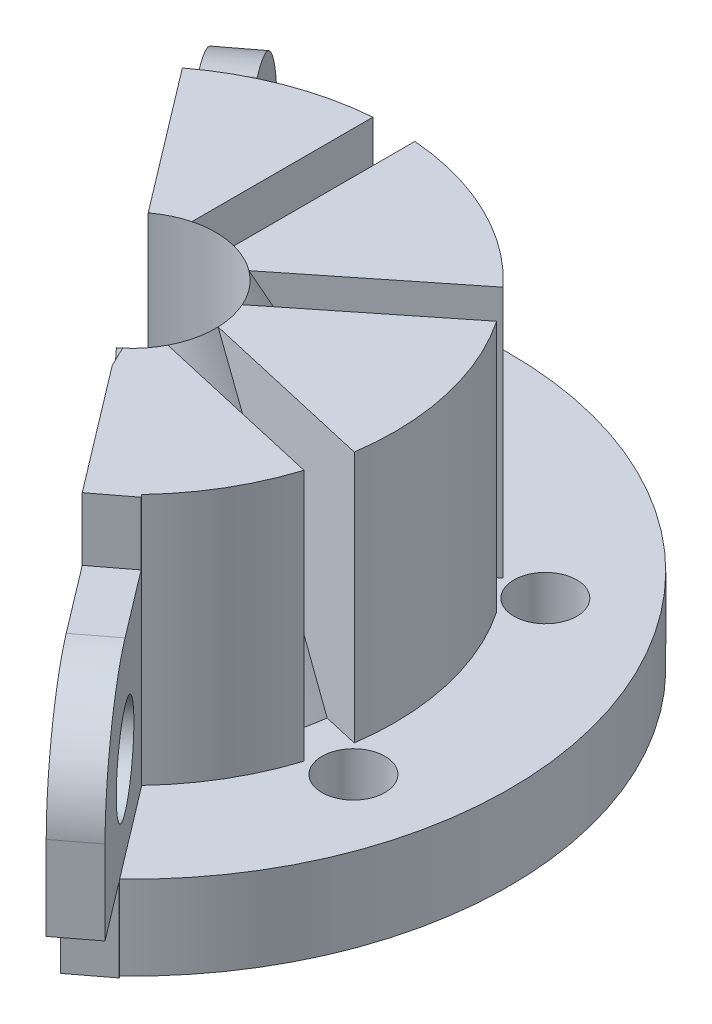
from build123d import *
from build123d.topology import SkipClean

# Parameters (mm, degrees)
SKETCH1_R               = 8.984375
SKETCH1_R_2             = 1.984375
SKETCH1_R_3             = 0.75
BOSS_EXTRUDE1_DEPTH     = 2
SKETCH6_W               = 17.96875
SKETCH6_H               = 8
CUT_EXTRUDE1_DEPTH      = 16.014593
BOSS_EXTRUDE4_START     = -1
BOSS_EXTRUDE4_OUTLINE_R = 1.1
BOSS_EXTRUDE4_DEPTH     = 1


with BuildPart() as part:
    # Sketch1 → Boss-Extrude1 (new body)
    with BuildSketch(Plane(origin=(0, 0, 0), x_dir=(1, 0, 0), z_dir=(0, 1, 0))):
        with Locations(Location((0, 0, 0), (0, 0, 270))):
            Circle(SKETCH1_R)
        with Locations(Location((0, 0, 0), (0, 0, 270))):
            Circle(SKETCH1_R_2, mode=Mode.SUBTRACT)
        with Locations(Location((0, 7, 0), (0, 0, 270))):
            Circle(SKETCH1_R_3, mode=Mode.SUBTRACT)
        with Locations(Location((5.47282, 4.364429, 0), (0, 0, 270))):
            Circle(SKETCH1_R_3, mode=Mode.SUBTRACT)
        with Locations(Location((6.824495, -1.557647, 0), (0, 0, 270))):
            Circle(SKETCH1_R_3, mode=Mode.SUBTRACT)
        with Locations(Location((3.037186, -6.306782, 0), (0, 0, 270))):
            Circle(SKETCH1_R_3, mode=Mode.SUBTRACT)
        with Locations(Location((-3.037186, -6.306782, 0), (0, 0, 270))):
            Circle(SKETCH1_R_3, mode=Mode.SUBTRACT)
        with Locations(Location((-6.824495, -1.557647, 0), (0, 0, 270))):
            Circle(SKETCH1_R_3, mode=Mode.SUBTRACT)
        with Locations(Location((-5.47282, 4.364429, 0), (0, 0, 270))):
            Circle(SKETCH1_R_3, mode=Mode.SUBTRACT)
    extrude(amount=BOSS_EXTRUDE1_DEPTH)

    # Sweep1: sweep along a path in Sketch3
    with SkipClean():  # the faces are left unmerged after this step: merging them gives an invalid solid
        with BuildLine(Plane(origin=(0, 0, 0), x_dir=(0, 0, -1), z_dir=(1, 0, 0))) as sweep1_path:
            Line((0, 2), (0, 8))
        # Sketch2 → Sweep1 (sweep)
        with BuildSketch(Plane(origin=(0, 2, 0), x_dir=(1, 0, 0), z_dir=(0, 1, 0))):
            with BuildLine():
                Line((-0.5, 6.229968), (-0.5, 1.92035))
                ThreePointArc((-0.5, 1.92035), (-0.860988, 1.78786), (-1.189645, 1.588234))
                Line((-1.189645, 1.588234), (-4.55904, 4.275237))
                ThreePointArc((-4.55904, 4.275237), (-2.711773, 5.631055), (-0.5, 6.229968))
            make_face()
            with BuildLine():
                Line((0.5, 6.229968), (0.5, 1.92035))
                ThreePointArc((0.5, 1.92035), (0.860988, 1.78786), (1.189645, 1.588234))
                Line((1.189645, 1.588234), (4.55904, 4.275237))
                ThreePointArc((4.55904, 4.275237), (2.711773, 5.631055), (0.5, 6.229968))
            make_face()
            with BuildLine():
                Line((5.18253, 3.493406), (1.813135, 0.806403))
                ThreePointArc((1.813135, 0.806403), (1.934623, 0.441565), (1.983463, 0.060146))
                Line((1.983463, 0.060146), (6.18503, -0.898834))
                ThreePointArc((6.18503, -0.898834), (6.093299, 1.390756), (5.18253, 3.493406))
            make_face()
            with BuildLine():
                Line((5.962509, -1.873762), (1.760942, -0.914782))
                ThreePointArc((1.760942, -0.914782), (1.551447, -1.237238), (1.283693, -1.513234))
                Line((1.283693, -1.513234), (3.153566, -5.396065))
                ThreePointArc((3.153566, -5.396065), (4.886447, -3.896811), (5.962509, -1.873762))
            make_face()
            with BuildLine():
                Line((2.252597, -5.829949), (0.382724, -1.947117))
                ThreePointArc((0.382724, -1.947117), (0, -1.984375), (-0.382724, -1.947117))
                Line((-0.382724, -1.947117), (-2.252597, -5.829949))
                ThreePointArc((-2.252597, -5.829949), (0, -6.25), (2.252597, -5.829949))
            make_face()
            with BuildLine():
                Line((-3.153566, -5.396065), (-1.283693, -1.513234))
                ThreePointArc((-1.283693, -1.513234), (-1.551447, -1.237238), (-1.760942, -0.914782))
                Line((-1.760942, -0.914782), (-5.962509, -1.873762))
                ThreePointArc((-5.962509, -1.873762), (-4.886447, -3.896811), (-3.153566, -5.396065))
            make_face()
            with BuildLine():
                Line((-6.18503, -0.898834), (-1.983463, 0.060146))
                ThreePointArc((-1.983463, 0.060146), (-1.934623, 0.441565), (-1.813135, 0.806403))
                Line((-1.813135, 0.806403), (-5.18253, 3.493406))
                ThreePointArc((-5.18253, 3.493406), (-6.093299, 1.390756), (-6.18503, -0.898834))
            make_face()
        sweep(path=sweep1_path.line)

    # Sketch4 → Revolve1 (revolve)
    with SkipClean():  # the faces are left unmerged after this step: merging them gives an invalid solid
        with BuildSketch(Plane(origin=(0, 0, 0), x_dir=(0, 0, -1), z_dir=(1, 0, 0)), mode=Mode.PRIVATE) as revolve1_sk:
            Polygon((-5.396065, 2), (-1.984375, 2), (-1.984375, 8), align=None)
        revolve(revolve1_sk.sketch.rotate(Axis((0, 0, 0), (0, 1, 0)), 165.405971), axis=Axis((0, 0, 0), (0, 1, 0)))

    # Sketch6 → Cut-Extrude1 (cut, through all)
    with BuildSketch(Plane(origin=(0, 0, 0), x_dir=(0.6052939880428899, 0, 0.7960020025346255), z_dir=(-0.7960020025346255, 0, 0.6052939880428899))):
        with Locations((0, 4)):
            Rectangle(SKETCH6_W, SKETCH6_H)
    extrude(amount=CUT_EXTRUDE1_DEPTH, mode=Mode.SUBTRACT)

    # Boss-Extrude4: read off the stored shape, not the designer's step
    # Boss-Extrude4 outline → Boss-Extrude4 (add)
    # profile 1 of 2: a face of its own
    with BuildSketch(Plane(origin=(0, 0, 0), x_dir=(0.60529398804289, 0, 0.7960020025346255), z_dir=(-0.7960020025346254, 0, 0.6052939880428899)).offset(BOSS_EXTRUDE4_START)):
        with BuildLine():
            Line((-6.169481, 6.5), (-8.25, 6.5))
            ThreePointArc((-8.25, 6.5), (-10.017767, 5.767767), (-10.75, 4))
            Line((-10.75, 4), (-10.75, 2))
            Line((-10.75, 2), (-6.169481, 2))
            Line((-6.169481, 2), (-6.169481, 6.5))
        make_face()
        with Locations((-8.25, 4)):
            Circle(BOSS_EXTRUDE4_OUTLINE_R, mode=Mode.SUBTRACT)
    # profile 2 of 2: a face of its own
    with BuildSketch(Plane(origin=(0, 0, 0), x_dir=(0.60529398804289, 0, 0.7960020025346255), z_dir=(-0.7960020025346254, 0, 0.6052939880428899)).offset(BOSS_EXTRUDE4_START)):
        with BuildLine():
            Line((8.984375, 0), (8.984375, 2))
            Line((8.984375, 2), (10.75, 2))
            Line((10.75, 2), (10.75, 4))
            ThreePointArc((10.75, 4), (10.017767, 5.767767), (8.25, 6.5))
            Line((8.25, 6.5), (6.25, 6.5))
            Line((6.25, 6.5), (6.25, 8))
            Line((6.25, 8), (2.500266, 8))
            Line((2.500266, 8), (2.500266, 7.092723))
            Line((2.500266, 7.092723), (1.984375, 8))
            Line((1.984375, 8), (1.984375, 0))
            Line((1.984375, 0), (8.984375, 0))
        make_face()
        with Locations((8.25, 4)):
            Circle(BOSS_EXTRUDE4_OUTLINE_R, mode=Mode.SUBTRACT)
    extrude(amount=BOSS_EXTRUDE4_DEPTH)


solid = part.part
